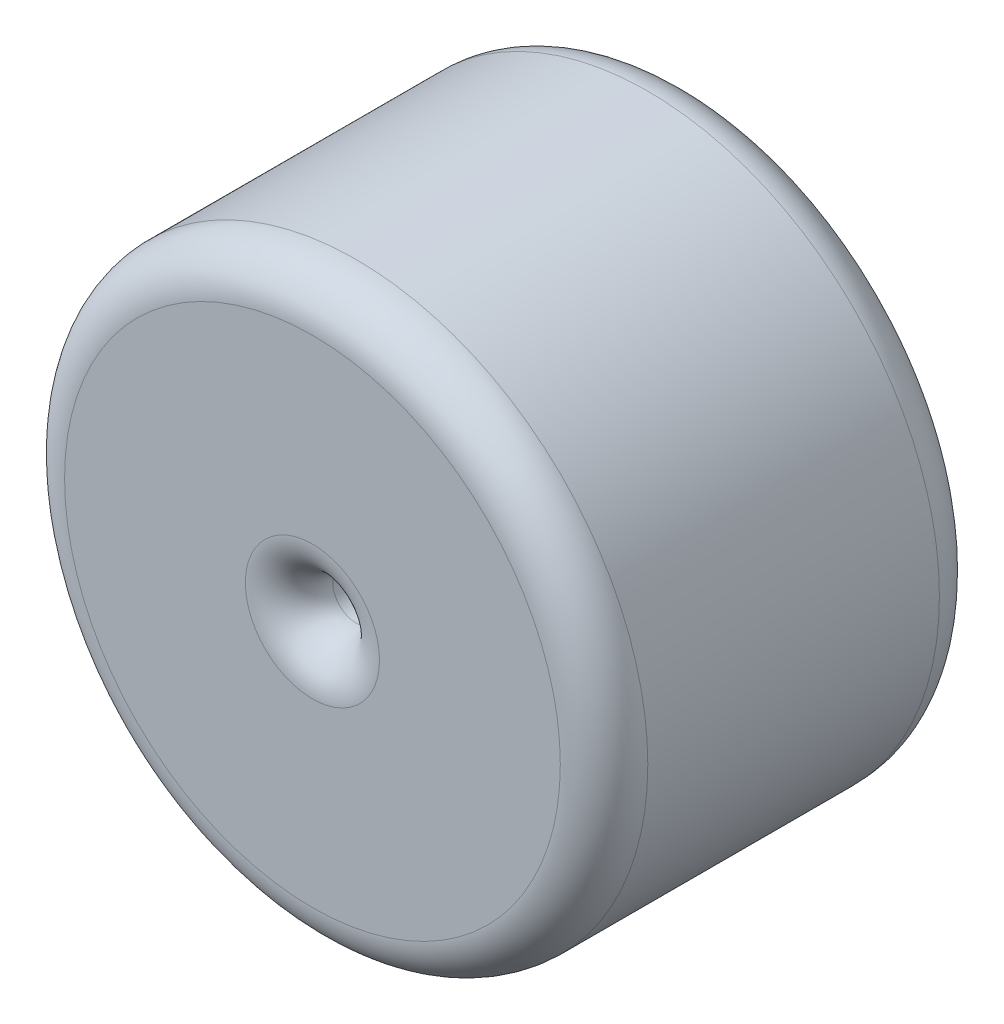
from build123d import *

# Parameters (mm, degrees)
SKETCH_1_R      = 20
SKETCH_1_R_2    = 1.6
EXTRUDE_1_DEPTH = 13
FILLET_1_R      = 3


with BuildPart() as part:
    # 草图1 → 凸台-拉伸1 (new, symmetric)
    with BuildSketch(Plane.XY):
        Circle(SKETCH_1_R)
        Circle(SKETCH_1_R_2, mode=Mode.SUBTRACT)
    extrude(amount=EXTRUDE_1_DEPTH, both=True)

    # 圆角1
    fillet_1_edges = [part.edges().sort_by_distance(p)[0] for p in [
        (-1.6, 0, -13),
        (-1.6, 0, 13),
        (-20, 0, -13),
        (-20, 0, 13),
    ]]
    fillet(fillet_1_edges, radius=FILLET_1_R)


solid = part.part
